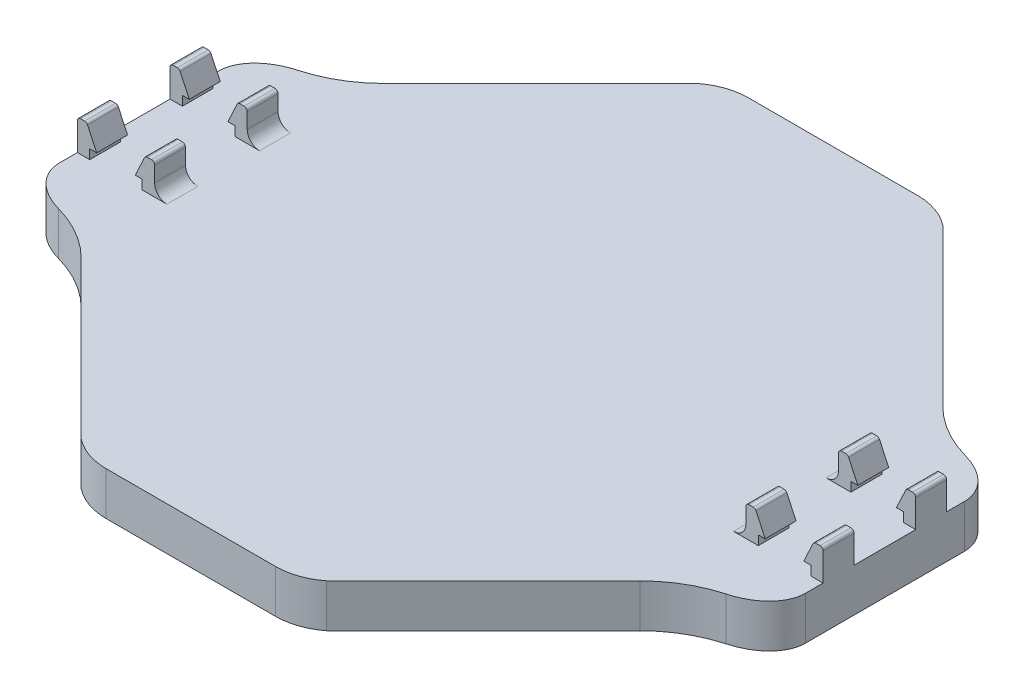
from build123d import *

# Parameters (mm, degrees)
SKETCH1_W            = 99.75
SKETCH1_H            = 99.75
BOSS_EXTRUDE5_DEPTH  = 7
CHAMFER2_SIZE        = 30
SKETCH6_W            = 39.75
SKETCH6_H            = 7
BOSS_EXTRUDE7_DEPTH  = 2.13
SKETCH8_W            = 39.75
SKETCH8_H            = 7
BOSS_EXTRUDE10_DEPTH = 2.13
SKETCH12_W           = 39.75
SKETCH12_H           = 7
BOSS_EXTRUDE14_DEPTH = 10.5
SKETCH14_W           = 39.75
SKETCH14_H           = 7
BOSS_EXTRUDE16_DEPTH = 10.5
SKETCH15_W           = 2
SKETCH15_H           = 5
BOSS_EXTRUDE17_DEPTH = 5
FILLET5_R            = 2
SKETCH16_W           = 5
SKETCH16_H           = 3.48
BOSS_EXTRUDE18_DEPTH = 2
SKETCH17_W           = 5
SKETCH17_H           = 3.48
BOSS_EXTRUDE19_DEPTH = 2
SKETCH18_W           = 5
SKETCH18_H           = 3.48
BOSS_EXTRUDE20_DEPTH = 2
SKETCH19_W           = 5
SKETCH19_H           = 3.48
BOSS_EXTRUDE21_DEPTH = 2
CHAMFER6_SIZE        = 5.361267301
CHAMFER6_SIZE_2      = 2.5
CHAMFER7_SIZE        = 5.361267301
CHAMFER7_SIZE_2      = 2.5
FILLET6_R            = 0.5
FILLET7_SIZE         = 10
FILLET7_SIZE_2       = 7
FILLET8_R            = 20
FILLET9_R            = 10


with BuildPart() as part:
    # Sketch1 → Boss-Extrude5 (new body)
    with BuildSketch(Plane(origin=(0, 0, 0), x_dir=(1, 0, 0), z_dir=(0, 1, 0))):
        with Locations((49.875, 49.875)):
            Rectangle(SKETCH1_W, SKETCH1_H)
    extrude(amount=BOSS_EXTRUDE5_DEPTH)

    # Chamfer2
    chamfer2_edges = [part.edges().sort_by_distance(p)[0] for p in [
        (0, 3.5, -99.75),
        (99.75, 3.5, -99.75),
        (99.75, 3.5, 0),
        (0, 3.5, 0),
    ]]
    chamfer(chamfer2_edges, length=CHAMFER2_SIZE)

    # Sketch6 → Boss-Extrude7 (add)
    with BuildSketch(Plane.XY):
        with Locations((49.875, 3.5)):
            Rectangle(SKETCH6_W, SKETCH6_H)
    extrude(amount=BOSS_EXTRUDE7_DEPTH)

    # Sketch8 → Boss-Extrude10 (add)
    with BuildSketch(Plane(origin=(0, 0, -99.75), x_dir=(-1, 0, 0), z_dir=(0, 0, -1))):
        with Locations((-49.875, 3.5)):
            Rectangle(SKETCH8_W, SKETCH8_H)
    extrude(amount=BOSS_EXTRUDE10_DEPTH)

    # Sketch12 → Boss-Extrude14 (add)
    with BuildSketch(Plane.ZY):
        with Locations((-49.875, 3.5)):
            Rectangle(SKETCH12_W, SKETCH12_H)
    extrude(amount=BOSS_EXTRUDE14_DEPTH)

    # Sketch14 → Boss-Extrude16 (add)
    with BuildSketch(Plane(origin=(99.75, 0, 0), x_dir=(0, 0, -1), z_dir=(1, 0, 0))):
        with Locations((49.875, 3.5)):
            Rectangle(SKETCH14_W, SKETCH14_H)
    extrude(amount=BOSS_EXTRUDE16_DEPTH)

    # Sketch15 → Boss-Extrude17 (add)
    with BuildSketch(Plane(origin=(0, 7, 0), x_dir=(1, 0, 0), z_dir=(0, 1, 0))):
        with Locations((1, 42.375)):
            Rectangle(SKETCH15_W, SKETCH15_H)
        with Locations((1, 57.375)):
            Rectangle(SKETCH15_W, SKETCH15_H)
        with Locations((-9.5, 57.375)):
            Rectangle(SKETCH15_W, SKETCH15_H)
        with Locations((-9.5, 42.375)):
            Rectangle(SKETCH15_W, SKETCH15_H)
        with Locations((109.25, 42.375)):
            Rectangle(SKETCH15_W, SKETCH15_H)
        with Locations((109.25, 57.375)):
            Rectangle(SKETCH15_W, SKETCH15_H)
        with Locations((98.75, 57.375)):
            Rectangle(SKETCH15_W, SKETCH15_H)
        with Locations((98.75, 42.375)):
            Rectangle(SKETCH15_W, SKETCH15_H)
    extrude(amount=BOSS_EXTRUDE17_DEPTH)

    # Fillet5
    fillet5_edges = [part.edges().sort_by_distance(p)[0] for p in [
        (2, 7, -57.375),
        (97.75, 7, -57.375),
        (97.75, 7, -42.375),
        (2, 7, -42.375),
    ]]
    fillet(fillet5_edges, radius=FILLET5_R)

    # Sketch16 → Boss-Extrude18 (add)
    with BuildSketch(Plane(origin=(99.75, 0, 0), x_dir=(0, 0, -1), z_dir=(1, 0, 0))):
        with Locations((42.375, 10.26)):
            Rectangle(SKETCH16_W, SKETCH16_H)
        with Locations((57.375, 10.26)):
            Rectangle(SKETCH16_W, SKETCH16_H)
    extrude(amount=BOSS_EXTRUDE18_DEPTH)

    # Sketch17 → Boss-Extrude19 (add)
    with BuildSketch(Plane.ZY.offset(-108.25)):
        with Locations((-57.375, 10.26)):
            Rectangle(SKETCH17_W, SKETCH17_H)
        with Locations((-42.375, 10.26)):
            Rectangle(SKETCH17_W, SKETCH17_H)
    extrude(amount=BOSS_EXTRUDE19_DEPTH)

    # Sketch18 → Boss-Extrude20 (add)
    with BuildSketch(Plane.ZY):
        with Locations((-57.375, 10.26)):
            Rectangle(SKETCH18_W, SKETCH18_H)
        with Locations((-42.375, 10.26)):
            Rectangle(SKETCH18_W, SKETCH18_H)
    extrude(amount=BOSS_EXTRUDE20_DEPTH)

    # Sketch19 → Boss-Extrude21 (add)
    with BuildSketch(Plane(origin=(-8.5, 0, 0), x_dir=(0, 0, -1), z_dir=(1, 0, 0))):
        with Locations((57.375, 10.26)):
            Rectangle(SKETCH19_W, SKETCH19_H)
        with Locations((42.375, 10.26)):
            Rectangle(SKETCH19_W, SKETCH19_H)
    extrude(amount=BOSS_EXTRUDE21_DEPTH)

    # Chamfer6
    # the kernel refuses this chamfer: 5.361267301, 2.5 mm, written as the material it takes off along each edge
    with BuildSketch(Plane(origin=(106.25, 12, -44.875), x_dir=(-0.016311164131111014, -0.9998669641130703, 0), z_dir=(0, 0, 1))) as chamfer6_piece_1_section:
        Polygon((CHAMFER6_SIZE * 0.999866964164, CHAMFER6_SIZE * 0.0163111641319), (-CHAMFER6_SIZE_2 * 0.0163111641311, CHAMFER6_SIZE_2 * 0.999866964113), (0, 0), align=None)
    chamfer6_piece_1 = extrude(amount=18.890912073, mode=Mode.PRIVATE)
    chamfer6_piece_1 = split(chamfer6_piece_1, bisect_by=Plane(origin=(107.159289271, 8.52, -42.375), z_dir=(0, 1, 0)), keep=Keep.TOP, mode=Mode.PRIVATE)
    add(chamfer6_piece_1, mode=Mode.SUBTRACT)

    # Chamfer7
    # the kernel refuses this chamfer: 5.361267301, 2.5 mm, written as the material it takes off along each edge
    with BuildSketch(Plane(origin=(101.75, 12, -58.765912073), x_dir=(0.016311164131111014, -0.9998669641130703, 0), z_dir=(0, 0, 1))) as chamfer7_piece_1_section:
        Polygon((CHAMFER7_SIZE * 0.999866964164, -CHAMFER7_SIZE * 0.0163111641319), (-CHAMFER7_SIZE_2 * 0.0163111641311, -CHAMFER7_SIZE_2 * 0.999866964113), (0, 0), align=None)
    chamfer7_piece_1 = extrude(amount=32.781824147, mode=Mode.PRIVATE)
    chamfer7_piece_1 = split(chamfer7_piece_1, bisect_by=Plane(origin=(100.840710729, 8.52, -56.820456037), z_dir=(0, 1, 0)), keep=Keep.TOP, mode=Mode.PRIVATE)
    add(chamfer7_piece_1, mode=Mode.SUBTRACT)
    with BuildSketch(Plane(origin=(101.75, 12, -40.984087927), x_dir=(0.016311164131111014, -0.9998669641130703, 0), z_dir=(0, 0, -1))) as chamfer7_piece_2_section:
        Polygon((CHAMFER7_SIZE * 0.999866964164, CHAMFER7_SIZE * 0.0163111641319), (-CHAMFER7_SIZE_2 * 0.0163111641311, CHAMFER7_SIZE_2 * 0.999866964113), (0, 0), align=None)
    chamfer7_piece_2 = extrude(amount=32.781824147, mode=Mode.PRIVATE)
    chamfer7_piece_2 = split(chamfer7_piece_2, bisect_by=Plane(origin=(100.840710729, 8.52, -42.929543963), z_dir=(0, 1, 0)), keep=Keep.TOP, mode=Mode.PRIVATE)
    add(chamfer7_piece_2, mode=Mode.SUBTRACT)
    with BuildSketch(Plane(origin=(106.25, 12, -40.984087927), x_dir=(0.9971975577536774, 0.07481330637060021, 0), z_dir=(0, 0, -1))) as chamfer7_piece_3_section:
        Polygon((CHAMFER7_SIZE_2 * 0.997197557754, CHAMFER7_SIZE_2 * 0.0748133063706), (-CHAMFER7_SIZE * 0.0748133063744, CHAMFER7_SIZE * 0.997197557805), (0, 0), align=None)
    chamfer7_piece_3 = extrude(amount=32.781824147, mode=Mode.PRIVATE)
    chamfer7_piece_3 = split(chamfer7_piece_3, bisect_by=Plane(origin=(107.159289271, 8.52, -57.375), z_dir=(0, 1, 0)), keep=Keep.TOP, mode=Mode.PRIVATE)
    add(chamfer7_piece_3, mode=Mode.SUBTRACT)
    with BuildSketch(Plane(origin=(-2, 12, -40.984087927), x_dir=(-0.016311164131110216, -0.9998669641130703, 0), z_dir=(0, 0, -1))) as chamfer7_piece_4_section:
        Polygon((CHAMFER7_SIZE * 0.999866964164, -CHAMFER7_SIZE * 0.0163111641319), (-CHAMFER7_SIZE_2 * 0.0163111641311, -CHAMFER7_SIZE_2 * 0.999866964113), (0, 0), align=None)
    chamfer7_piece_4 = extrude(amount=32.781824147, mode=Mode.PRIVATE)
    chamfer7_piece_4 = split(chamfer7_piece_4, bisect_by=Plane(origin=(-1.090710729, 8.52, -42.929543963), z_dir=(0, 1, 0)), keep=Keep.TOP, mode=Mode.PRIVATE)
    add(chamfer7_piece_4, mode=Mode.SUBTRACT)
    with BuildSketch(Plane(origin=(-2, 12, -58.765912073), x_dir=(-0.016311164131110216, -0.9998669641130703, 0), z_dir=(0, 0, 1))) as chamfer7_piece_5_section:
        Polygon((CHAMFER7_SIZE * 0.999866964164, CHAMFER7_SIZE * 0.0163111641319), (-CHAMFER7_SIZE_2 * 0.0163111641311, CHAMFER7_SIZE_2 * 0.999866964113), (0, 0), align=None)
    chamfer7_piece_5 = extrude(amount=32.781824147, mode=Mode.PRIVATE)
    chamfer7_piece_5 = split(chamfer7_piece_5, bisect_by=Plane(origin=(-1.090710729, 8.52, -56.820456037), z_dir=(0, 1, 0)), keep=Keep.TOP, mode=Mode.PRIVATE)
    add(chamfer7_piece_5, mode=Mode.SUBTRACT)
    with BuildSketch(Plane(origin=(-6.5, 12, -40.984087927), x_dir=(-0.9971975577536774, 0.07481330637060031, 0), z_dir=(0, 0, -1))) as chamfer7_piece_6_section:
        Polygon((CHAMFER7_SIZE_2 * 0.997197557754, -CHAMFER7_SIZE_2 * 0.0748133063706), (-CHAMFER7_SIZE * 0.0748133063744, -CHAMFER7_SIZE * 0.997197557805), (0, 0), align=None)
    chamfer7_piece_6 = extrude(amount=32.781824147, mode=Mode.PRIVATE)
    chamfer7_piece_6 = split(chamfer7_piece_6, bisect_by=Plane(origin=(-7.409289271, 8.52, -42.929543963), z_dir=(0, 1, 0)), keep=Keep.TOP, mode=Mode.PRIVATE)
    add(chamfer7_piece_6, mode=Mode.SUBTRACT)
    with BuildSketch(Plane(origin=(-6.5, 12, -25.984087927), x_dir=(-0.9971975577536774, 0.07481330637060031, 0), z_dir=(0, 0, -1))) as chamfer7_piece_7_section:
        Polygon((CHAMFER7_SIZE_2 * 0.997197557754, -CHAMFER7_SIZE_2 * 0.0748133063706), (-CHAMFER7_SIZE * 0.0748133063744, -CHAMFER7_SIZE * 0.997197557805), (0, 0), align=None)
    chamfer7_piece_7 = extrude(amount=32.781824147, mode=Mode.PRIVATE)
    chamfer7_piece_7 = split(chamfer7_piece_7, bisect_by=Plane(origin=(-7.409289271, 8.52, -42.375), z_dir=(0, 1, 0)), keep=Keep.TOP, mode=Mode.PRIVATE)
    add(chamfer7_piece_7, mode=Mode.SUBTRACT)

    # Fillet6
    fillet6_edges = [part.edges().sort_by_distance(p)[0] for p in [
        (2, 12, -57.375),
        (-10.5, 12, -57.375),
        (-10.5, 12, -42.375),
        (110.25, 12, -42.375),
        (110.25, 12, -57.375),
        (97.75, 12, -57.375),
        (97.75, 12, -42.375),
        (108.75, 12, -42.375),
        (-9, 12, -42.375),
        (-9, 12, -57.375),
        (0.5, 12, -57.375),
        (0.5, 12, -42.375),
        (99.25, 12, -42.375),
        (99.25, 12, -57.375),
        (108.75, 12, -57.375),
        (2, 12, -42.375),
    ]]
    fillet(fillet6_edges, radius=FILLET6_R)

    # Fillet7
    # an asymmetric fillet: 10, 7 mm, written as the material it takes off along each edge
    with BuildSketch(Plane(origin=(-10.5, 32, -69.75), x_dir=(1, 0, 0), z_dir=(0, -1, 0))) as fillet7_piece_1:
        with BuildLine():
            Bezier((FILLET7_SIZE, 0), (0, 0), (0, FILLET7_SIZE_2), weights=[1, 0.707106781, 1])
            Line((0, FILLET7_SIZE_2), (0, 0))
            Line((0, 0), (FILLET7_SIZE, 0))
        make_face()
    extrude(amount=57, mode=Mode.SUBTRACT)
    with BuildSketch(Plane(origin=(-10.5, -25, -30), x_dir=(0, 0, -1), z_dir=(0, 1, 0))) as fillet7_piece_2:
        with BuildLine():
            Bezier((FILLET7_SIZE_2, 0), (0, 0), (0, -FILLET7_SIZE), weights=[1, 0.707106781, 1])
            Line((0, -FILLET7_SIZE), (0, 0))
            Line((0, 0), (FILLET7_SIZE_2, 0))
        make_face()
    extrude(amount=57, mode=Mode.SUBTRACT)
    with BuildSketch(Plane(origin=(110.25, 32, -69.75), x_dir=(0, 0, 1), z_dir=(0, -1, 0))) as fillet7_piece_3:
        with BuildLine():
            Bezier((FILLET7_SIZE_2, 0), (0, 0), (0, FILLET7_SIZE), weights=[1, 0.707106781, 1])
            Line((0, FILLET7_SIZE), (0, 0))
            Line((0, 0), (FILLET7_SIZE_2, 0))
        make_face()
    extrude(amount=57, mode=Mode.SUBTRACT)
    with BuildSketch(Plane(origin=(110.25, -25, -30), x_dir=(-1, 0, 0), z_dir=(0, 1, 0))) as fillet7_piece_4:
        with BuildLine():
            Bezier((FILLET7_SIZE, 0), (0, 0), (0, -FILLET7_SIZE_2), weights=[1, 0.707106781, 1])
            Line((0, -FILLET7_SIZE_2), (0, 0))
            Line((0, 0), (FILLET7_SIZE, 0))
        make_face()
    extrude(amount=57, mode=Mode.SUBTRACT)

    # Fillet8
    fillet8_edges = [part.edges().sort_by_distance(p)[0] for p in [
        (0, 3.5, -30),
        (0, 3.5, -69.75),
        (99.75, 3.5, -69.75),
        (99.75, 3.5, -30),
    ]]
    fillet(fillet8_edges, radius=FILLET8_R)

    # Fillet9
    # the kernel refuses this fillet: 10 mm, written as the material it takes off along each edge
    with BuildSketch(Plane(origin=(30, -15.423824915, 2.13), x_dir=(0, 0, -1), z_dir=(0, 1, 0))) as fillet9_piece_1:
        with BuildLine():
            CenterArc((10, -6.169529966), FILLET9_R, 141.906034037, 38.093965963)
            Line((0, -6.169529966), (-0.2, -6.169529966))
            Line((-0.2, -6.169529966), (-0.2, 0))
            Line((-0.2, 0), (0, 0.2))
            ThreePointArc((0, 0.2), (1.065, 0.2), (1.9726, 0.123390599))
            Line((1.9726, 0.123390599), (2.13, 0))
        make_face()
    extrude(amount=37.847649829, mode=Mode.SUBTRACT)
    with BuildSketch(Plane(origin=(69.75, 22.423824915, 2.13), x_dir=(-1, 0, 0), z_dir=(0, -1, 0))) as fillet9_piece_2:
        with BuildLine():
            CenterArc((6.169529966, 10), FILLET9_R, 231.906034037, 38.093965963)
            Line((0, 2.13), (-0.123390599, 1.9726))
            ThreePointArc((-0.123390599, 1.9726), (-0.2, 1.065), (-0.2, 0))
            Line((-0.2, 0), (0, -0.2))
            Line((0, -0.2), (6.169529966, -0.2))
            Line((6.169529966, -0.2), (6.169529966, 0))
        make_face()
    extrude(amount=37.847649829, mode=Mode.SUBTRACT)
    with BuildSketch(Plane(origin=(30, -15.423824915, -101.88), x_dir=(0, 0, 1), z_dir=(0, 1, 0))) as fillet9_piece_3:
        with BuildLine():
            CenterArc((10, 6.169529966), FILLET9_R, 180, 38.093965963)
            Line((0, 6.169529966), (-0.2, 6.169529966))
            Line((-0.2, 6.169529966), (-0.2, 0))
            Line((-0.2, 0), (0, -0.2))
            ThreePointArc((0, -0.2), (1.065, -0.2), (1.9726, -0.123390599))
            Line((1.9726, -0.123390599), (2.13, 0))
        make_face()
    extrude(amount=37.847649829, mode=Mode.SUBTRACT)
    with BuildSketch(Plane(origin=(69.75, 22.423824915, -101.88), x_dir=(-1, 0, 0), z_dir=(0, -1, 0))) as fillet9_piece_4:
        with BuildLine():
            CenterArc((6.169529966, -10), FILLET9_R, 90, 38.093965963)
            Line((0, -2.13), (-0.123390599, -1.9726))
            ThreePointArc((-0.123390599, -1.9726), (-0.2, -1.065), (-0.2, 0))
            Line((-0.2, 0), (0, 0.2))
            Line((0, 0.2), (6.169529966, 0.2))
            Line((6.169529966, 0.2), (6.169529966, 0))
        make_face()
    extrude(amount=37.847649829, mode=Mode.SUBTRACT)


solid = part.part
